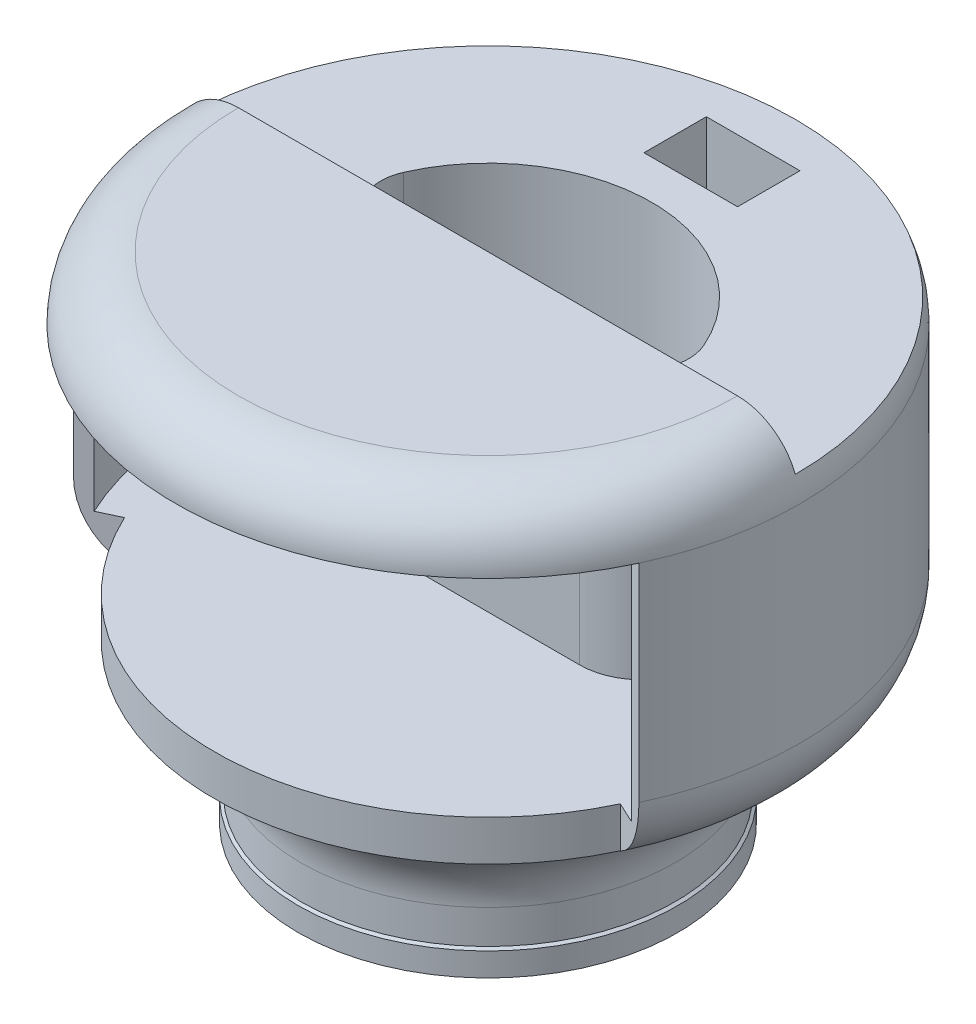
from build123d import *

# Parameters (mm, degrees)
CUT_EXTRUDE3_DEPTH           = 60
CUT_EXTRUDE5_DEPTH           = 2
CUT_EXTRUDE5_DEPTH_BACK      = 30
SKETCH9_R                    = 38
SKETCH9_R_2                  = 23
SKETCH19_W                   = 12
SKETCH19_H                   = 36.5
CUT_REVOLVE2_ANGLE           = 65
CUT_REVOLVE2_OTHER_WAY_ANGLE = 65
SKETCH21_W                   = 3.25
SKETCH21_H                   = 4
BOSS_EXTRUDE3_DEPTH          = 1.35
CIRPATTERN1_COUNT            = 5
CUT_EXTRUDE9_START           = -5
CUT_EXTRUDE9_DEPTH           = 5
SKETCH23_R                   = 10.5
CUT_EXTRUDE10_DEPTH          = 10
SKETCH24_W                   = 17
SKETCH24_H                   = 12
BOSS_EXTRUDE4_DEPTH          = 8
SKETCH26_W                   = 12
SKETCH26_H                   = 8
CUT_EXTRUDE11_DEPTH          = 10
SKETCH27_W                   = 4
SKETCH27_H                   = 5
CUT_EXTRUDE12_DEPTH          = 5
CUT_EXTRUDE14_DEPTH          = 2
CUT_EXTRUDE14_DEPTH_BACK     = 30
SKETCH29_R                   = 1
CUT_EXTRUDE15_DEPTH          = 15
FILLET1_R                    = 6
FILLET2_R                    = 8


with BuildPart() as part:
    # Sketch1 → Revolve1 (revolve)
    with BuildSketch(Plane.XY):
        with BuildLine():
            Line((0, 63.427876097), (32, 63.427876097))
            ThreePointArc((32, 63.427876097), (37.656854249, 61.084730346), (40, 55.427876097))
            Line((40, 55.427876097), (40, 28.846818009))
            ThreePointArc((40, 28.846818009), (38.792081772, 24.082439968), (35.460140376, 20.469057744))
            Line((35.460140376, 20.469057744), (28.539859624, 15.958818353))
            ThreePointArc((28.539859624, 15.958818353), (25.207918228, 12.345436129), (24, 7.581058088))
            Line((24, 7.581058088), (24, 3.25))
            Line((24, 3.25), (24.35, 3))
            Line((24.35, 3), (24.35, 0))
            Line((24.35, 0), (22.5, 0))
            Line((22.5, 0), (22.5, 12.5))
            ThreePointArc((22.5, 12.5), (22.353553391, 12.853553391), (22, 13))
            Line((22, 13), (0, 13))
            Line((0, 13), (0, 63.427876097))
        make_face()
    revolve(axis=Axis((0, 0, 0), (0, 1, 0)))

    # Sketch11 → Cut-Extrude3 (cut)
    with BuildSketch(Plane(origin=(0, 13, 0), x_dir=(-1, 0, 0), z_dir=(0, -1, 0))):
        with BuildLine():
            Line((-21, 0), (21, 0))
            ThreePointArc((21, 0), (0, 21), (-21, 0))
        make_face()
    extrude(amount=-CUT_EXTRUDE3_DEPTH, mode=Mode.SUBTRACT)

    # Sketch9 → Cut-Extrude5 (cut, two sides: drawn at the far end of the back side and taken through both)
    with BuildSketch(Plane(origin=(0, 55.427876097, 0), x_dir=(1, 0, 0), z_dir=(0, 1, 0)).offset(-CUT_EXTRUDE5_DEPTH_BACK)):
        Circle(SKETCH9_R)
        Circle(SKETCH9_R_2, mode=Mode.SUBTRACT)
    extrude(amount=CUT_EXTRUDE5_DEPTH + CUT_EXTRUDE5_DEPTH_BACK, mode=Mode.SUBTRACT)

    # Sketch19 → Cut-Revolve2 (revolve, cut)
    with BuildSketch(Plane(origin=(0, 0, 0), x_dir=(0, 0, -1), z_dir=(1, 0, 0))):
        with Locations((-41.064715832, 37.177876097)):
            Rectangle(SKETCH19_W, SKETCH19_H)
    revolve(axis=Axis((0, 0, 0), (0, 1, 0)), revolution_arc=CUT_REVOLVE2_ANGLE, mode=Mode.SUBTRACT)

    # Sketch19 → Cut-Revolve2 other way (revolve, cut)
    with BuildSketch(Plane(origin=(0, 0, 0), x_dir=(0, 0, -1), z_dir=(1, 0, 0))):
        with Locations((-41.064715832, 37.177876097)):
            Rectangle(SKETCH19_W, SKETCH19_H)
    revolve(axis=Axis((0, 0, 0), (0, -1, 0)), revolution_arc=CUT_REVOLVE2_OTHER_WAY_ANGLE, mode=Mode.SUBTRACT)

    # Sketch21 → Boss-Extrude3 (add)
    with BuildSketch(Plane(origin=(0, 0, 22.5), x_dir=(-1, 0, 0), z_dir=(0, 0, -1))):
        with Locations((0, 2)):
            Rectangle(SKETCH21_W, SKETCH21_H)
    boss_extrude3 = extrude(amount=BOSS_EXTRUDE3_DEPTH)

    # CirPattern1: Boss-Extrude3 ×5 about axis
    cirpattern1_axis = Axis((0, 0, 0), (0, -1, 0))
    for i in range(1, CIRPATTERN1_COUNT):
        add(boss_extrude3.rotate(cirpattern1_axis, i * 360 / CIRPATTERN1_COUNT))

    # Sketch22 → Cut-Extrude9 (cut)
    with BuildSketch(Plane(origin=(0, 63.427876097, 0), x_dir=(1, 0, 0), z_dir=(0, 1, 0)).offset(CUT_EXTRUDE9_START)):
        with BuildLine():
            Line((-40, 0), (40, 0))
            ThreePointArc((40, 0), (0, 40), (-40, 0))
        make_face()
    extrude(amount=CUT_EXTRUDE9_DEPTH, mode=Mode.SUBTRACT)

    # Sketch23 → Cut-Extrude10 (cut)
    with BuildSketch(Plane(origin=(0, 0, -40), x_dir=(-1, 0, 0), z_dir=(0, 0, -1))):
        with Locations((0, 42.137876097)):
            Circle(SKETCH23_R)
    extrude(amount=-CUT_EXTRUDE10_DEPTH, mode=Mode.SUBTRACT)

    # Sketch24 → Boss-Extrude4 (add)
    with BuildSketch(Plane(origin=(0, 58.427876097, 0), x_dir=(1, 0, 0), z_dir=(0, 1, 0))):
        with Locations((0, 30)):
            Rectangle(SKETCH24_W, SKETCH24_H)
    extrude(amount=-BOSS_EXTRUDE4_DEPTH)

    # Sketch26 → Cut-Extrude11 (cut)
    with BuildSketch(Plane(origin=(0, 58.427876097, 0), x_dir=(1, 0, 0), z_dir=(0, 1, 0))):
        with Locations((0, 30)):
            Rectangle(SKETCH26_W, SKETCH26_H)
    extrude(amount=-CUT_EXTRUDE11_DEPTH, mode=Mode.SUBTRACT)

    # Sketch27 → Cut-Extrude12 (cut)
    with BuildSketch(Plane(origin=(8.5, 0, 0), x_dir=(0, 0, -1), z_dir=(1, 0, 0))):
        with Locations((29.5, 53.927876097)):
            Rectangle(SKETCH27_W, SKETCH27_H)
    extrude(amount=-CUT_EXTRUDE12_DEPTH, mode=Mode.SUBTRACT)

    # Sketch28 → Cut-Extrude14 (cut, two sides: drawn at the far end of the back side and taken through both)
    with BuildSketch(Plane(origin=(0, 55.427876097, 0), x_dir=(1, 0, 0), z_dir=(0, 1, 0)).offset(-CUT_EXTRUDE14_DEPTH_BACK)):
        with BuildLine():
            Line((-22.912878475, -2), (22.912878475, -2))
            ThreePointArc((22.912878475, -2), (0, -23), (-22.912878475, -2))
        make_face()
    extrude(amount=CUT_EXTRUDE14_DEPTH + CUT_EXTRUDE14_DEPTH_BACK, mode=Mode.SUBTRACT)

    # Sketch29 → Cut-Extrude15 (cut)
    with BuildSketch(Plane(origin=(0, 0, 0), x_dir=(-1, 0, 0), z_dir=(0, 0, -1))):
        with Locations((-30.416198487, 60.927876097)):
            Circle(SKETCH29_R)
        with Locations((30.416198487, 60.927876097)):
            Circle(SKETCH29_R)
        with Locations((0, 60.927876097)):
            Circle(SKETCH29_R)
    extrude(amount=-CUT_EXTRUDE15_DEPTH, mode=Mode.SUBTRACT)

    # Fillet1
    fillet1_edges = [part.edges().sort_by_distance(p)[0] for p in [
        (-21, 35.713938048, 0),
        (21, 35.713938048, 0),
    ]]
    fillet(fillet1_edges, radius=FILLET1_R)

    # Fillet2
    fillet2_edges = [part.edges().sort_by_distance(p)[0] for p in [
        (22.912878475, 41.427876097, 2),
        (-22.912878475, 41.427876097, 2),
    ]]
    fillet(fillet2_edges, radius=FILLET2_R)


solid = part.part
